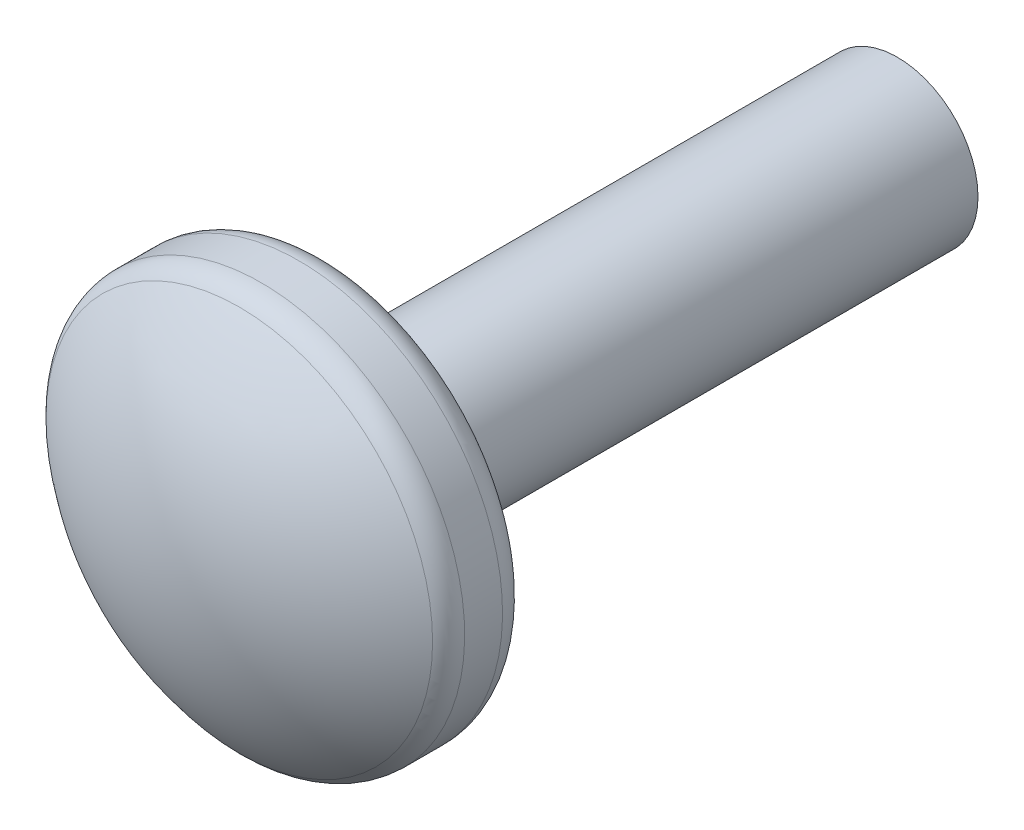
from build123d import *

# Parameters (mm, degrees)
SKETCH3_W = 14
SKETCH3_H = 1.980384758
SKETCH8_W = 3.9
SKETCH8_H = 5


with BuildPart() as part:
    # Sketch3 → Revolve1 (revolve)
    with BuildSketch(Plane(origin=(0, 0, 0), x_dir=(0, 0, -1), z_dir=(1, 0, 0))):
        with Locations((-7, 0.990192379)):
            Rectangle(SKETCH3_W, SKETCH3_H)
    revolve(axis=Axis((0, 0, 0), (0, 0, -1)))

    # Sketch8 → Revolve2 (revolve)
    with BuildSketch(Plane(origin=(0, 0, 0), x_dir=(0, 0, -1), z_dir=(1, 0, 0))):
        with Locations((-15.95, 2.5)):
            Rectangle(SKETCH8_W, SKETCH8_H)
    revolve(axis=Axis((0, 0, 0), (0, 0, 1)))

    # Sketch11 → Cut-Revolve3 (revolve, cut)
    with BuildSketch(Plane(origin=(0, 0, 0), x_dir=(0, 0, -1), z_dir=(1, 0, 0))):
        with BuildLine():
            Line((-15.632664285, 5), (-14.702, 5))
            ThreePointArc((-14.702, 5), (-14.20561104, 4.79438896), (-14, 4.298))
            Line((-14, 4.298), (-13.365, 4.298))
            Line((-13.365, 4.298), (-13.365, 5.635))
            Line((-13.365, 5.635), (-18.535, 5.635))
            Line((-18.535, 5.635), (-18.535, 0))
            Line((-18.535, 0), (-17.9, 0))
            ThreePointArc((-17.9, 0), (-17.454099823, 2.527320184), (-16.170243589, 4.749455969))
            ThreePointArc((-16.170243589, 4.749455969), (-15.929212687, 4.934288492), (-15.632664285, 5))
        make_face()
    revolve(axis=Axis((0, 0, 17.9), (0, 0, -1)), mode=Mode.SUBTRACT)


solid = part.part
